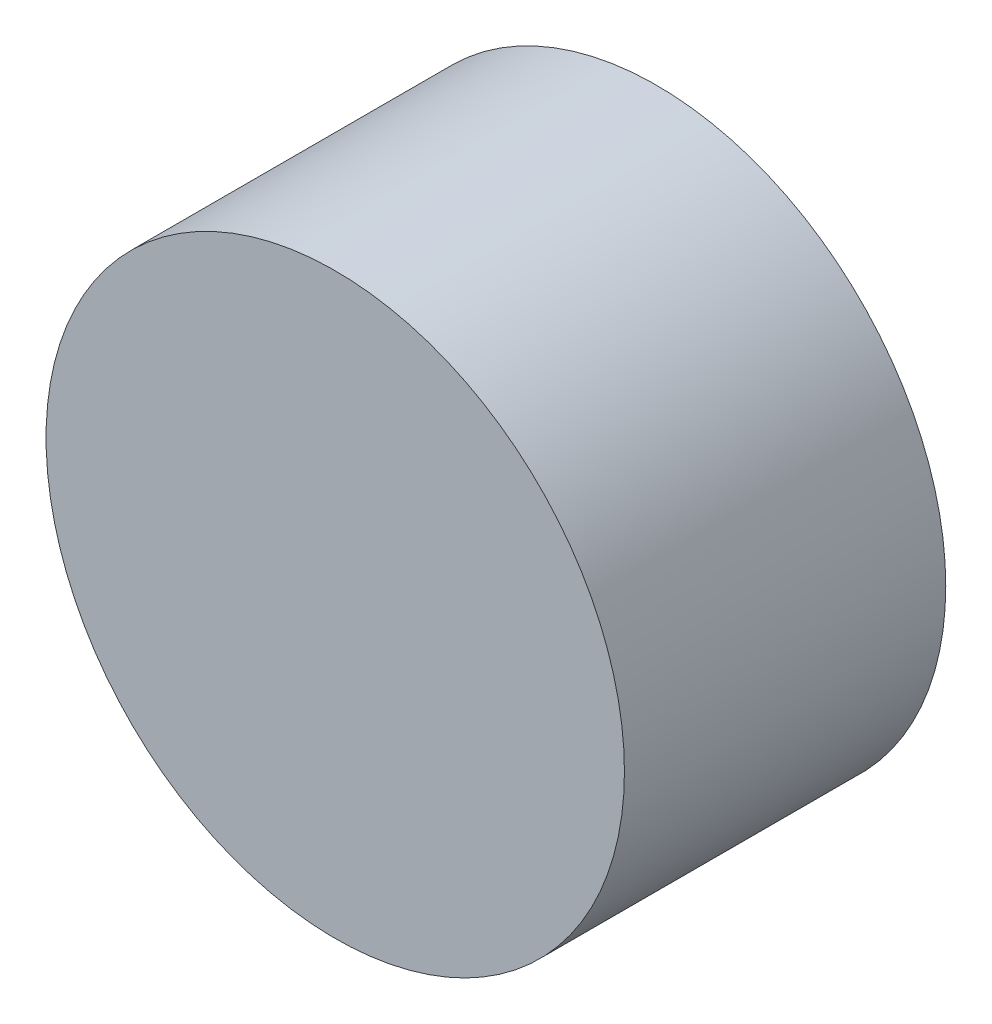
from build123d import *

# Parameters (mm, degrees)
SKETCH1_R           = 3.6
BOSS_EXTRUDE1_DEPTH = 4


with BuildPart() as part:
    # Sketch1 → Boss-Extrude1 (new body)
    with BuildSketch(Plane.XY):
        Circle(SKETCH1_R)
    extrude(amount=BOSS_EXTRUDE1_DEPTH)


solid = part.part
